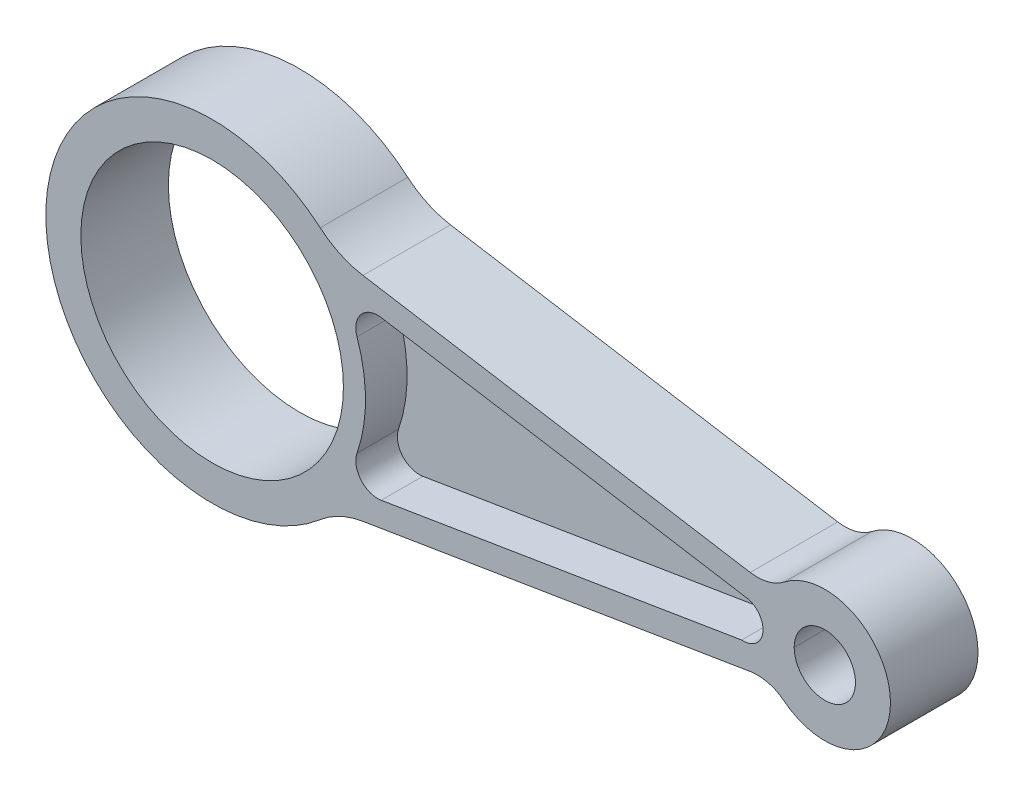
from build123d import *

# Parameters (mm, degrees)
SKETCH1_R           = 30
SKETCH1_R_2         = 7
BOSS_EXTRUDE1_DEPTH = 10
FILLET1_R           = 20
FILLET2_R           = 10
CUT_EXTRUDE1_DEPTH  = 9.5


with BuildPart() as part:
    # Sketch1 → Boss-Extrude1 (new, symmetric)
    with BuildSketch(Plane.XY):
        with BuildLine():
            Line((28.309347234, -25.349178669), (127.980959562, -8.974556643))
            ThreePointArc((127.980959562, -8.974556643), (155, 0), (127.980959562, 8.974556643))
            Line((127.980959562, 8.974556643), (28.309347234, 25.349178669))
            ThreePointArc((28.309347234, 25.349178669), (-38, 0), (28.309347234, -25.349178669))
        make_face()
        Circle(SKETCH1_R, mode=Mode.SUBTRACT)
        with Locations((140, 0)):
            Circle(SKETCH1_R_2, mode=Mode.SUBTRACT)
    extrude(amount=BOSS_EXTRUDE1_DEPTH, both=True)

    # Fillet1
    fillet1_edges = [part.edges().sort_by_distance(p)[0] for p in [
        (28.309347234, -25.349178669, 0),
        (28.309347234, 25.349178669, 0),
    ]]
    fillet(fillet1_edges, radius=FILLET1_R)

    # Fillet2
    fillet2_edges = [part.edges().sort_by_distance(p)[0] for p in [
        (127.980959562, -8.974556643, 0),
        (127.980959562, 8.974556643, 0),
    ]]
    fillet(fillet2_edges, radius=FILLET2_R)

    # Sketch2 → Cut-Extrude1 (cut)
    with BuildSketch(Plane.XY.offset(10)):
        with BuildLine():
            Line((38.638691874, 18.07848713), (121.848393563, 4.408321852))
            ThreePointArc((121.848393563, 4.408321852), (125.854189802, -0.497633455), (120.986555874, -4.549909473))
            Line((120.986555874, -4.549909473), (38.638691874, -18.07848713))
            ThreePointArc((38.638691874, -18.07848713), (34.002624892, -16.364178365), (33.10514216, -11.503468916))
            ThreePointArc((33.10514216, -11.503468916), (35.046829165, 0), (33.10514216, 11.503468916))
            ThreePointArc((33.10514216, 11.503468916), (34.002624892, 16.364178365), (38.638691874, 18.07848713))
        make_face()
    cut_extrude1 = extrude(amount=-CUT_EXTRUDE1_DEPTH, mode=Mode.SUBTRACT)

    # Mirror1: Cut-Extrude1 across plane
    add(cut_extrude1.mirror(Plane.XY), mode=Mode.SUBTRACT)


solid = part.part
